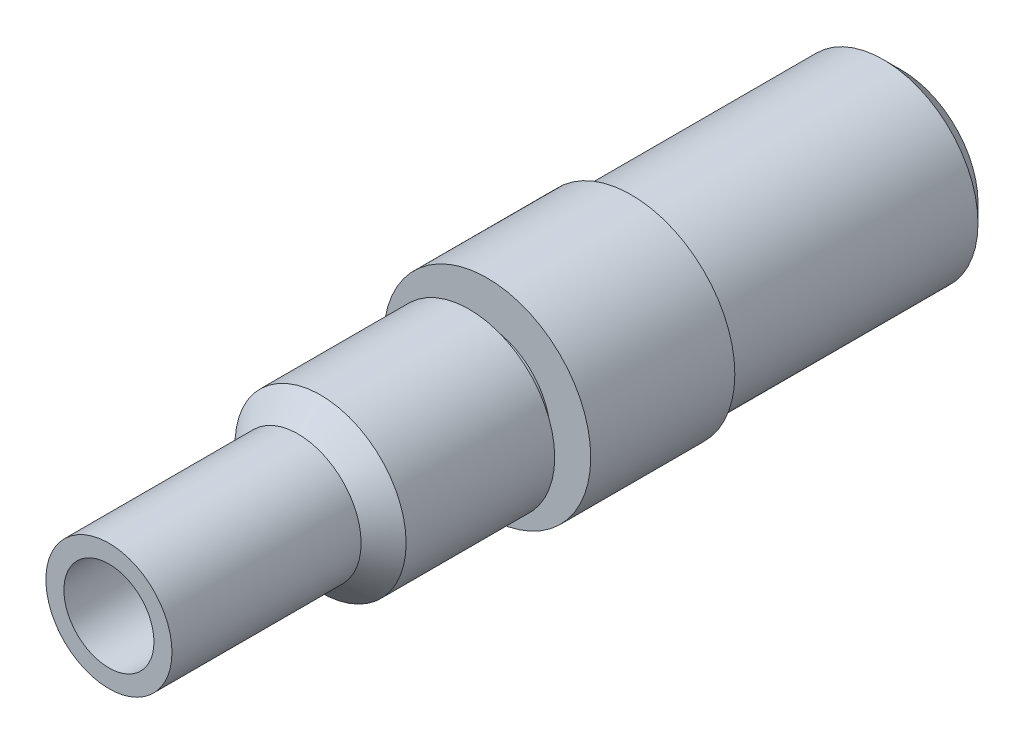
from build123d import *

# Parameters (mm, degrees)
ESQUISSE1_R        = 5.25
ESQUISSE1_R_2      = 2.5
BOSS_EXTRU_1_DEPTH = 15
ESQUISSE2_R        = 5.75
ESQUISSE2_R_2      = 2.5
BOSS_EXTRU_2_DEPTH = 8
ESQUISSE3_R        = 3.5
ESQUISSE3_R_2      = 2.5
BOSS_EXTRU_3_DEPTH = 1
ESQUISSE4_R        = 4.75
ESQUISSE4_R_2      = 2.5
BOSS_EXTRU_4_DEPTH = 8.25
ESQUISSE5_R        = 3.5
ESQUISSE5_R_2      = 2.5
BOSS_EXTRU_5_DEPTH = 11.75
CHANFREIN1_SIZE    = 1.25
CHANFREIN2_SIZE    = 1


with BuildPart() as part:
    # Esquisse1 → Boss.-Extru.1 (new body)
    with BuildSketch(Plane.XY):
        Circle(ESQUISSE1_R)
        Circle(ESQUISSE1_R_2, mode=Mode.SUBTRACT)
    extrude(amount=BOSS_EXTRU_1_DEPTH)

    # Esquisse2 → Boss.-Extru.2 (add)
    with BuildSketch(Plane.XY.offset(15)):
        Circle(ESQUISSE2_R)
        Circle(ESQUISSE2_R_2, mode=Mode.SUBTRACT)
    extrude(amount=BOSS_EXTRU_2_DEPTH)

    # Esquisse3 → Boss.-Extru.3 (add)
    with BuildSketch(Plane.XY.offset(23)):
        Circle(ESQUISSE3_R)
        Circle(ESQUISSE3_R_2, mode=Mode.SUBTRACT)
    extrude(amount=BOSS_EXTRU_3_DEPTH)

    # Esquisse4 → Boss.-Extru.4 (add)
    with BuildSketch(Plane.XY.offset(24)):
        Circle(ESQUISSE4_R)
        Circle(ESQUISSE4_R_2, mode=Mode.SUBTRACT)
    extrude(amount=BOSS_EXTRU_4_DEPTH)

    # Esquisse5 → Boss.-Extru.5 (add)
    with BuildSketch(Plane.XY.offset(32.25)):
        Circle(ESQUISSE5_R)
        Circle(ESQUISSE5_R_2, mode=Mode.SUBTRACT)
    extrude(amount=BOSS_EXTRU_5_DEPTH)

    # Chanfrein1
    chanfrein1_edges = [part.edges().sort_by_distance(p)[0] for p in [
        (-3.5, 0, 32.25),
    ]]
    chamfer(chanfrein1_edges, length=CHANFREIN1_SIZE - 0.0001)  # a hair under: the kernel refuses the full size

    # Chanfrein2
    chanfrein2_edges = [part.edges().sort_by_distance(p)[0] for p in [
        (-5.25, 0, 0),
    ]]
    chamfer(chanfrein2_edges, length=CHANFREIN2_SIZE)


solid = part.part
